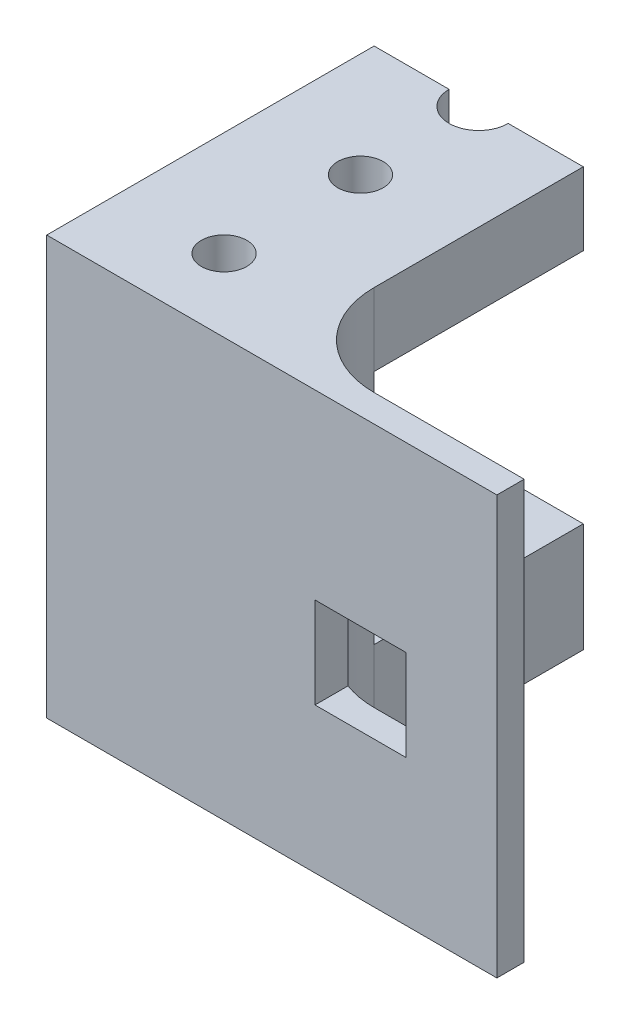
from build123d import *

# Parameters (mm, degrees)
SKETCH1_W                 = 23
SKETCH1_H                 = 33
BOSS_EXTRUDE1_DEPTH       = 46
CUT_EXTRUDE1_START        = 12
SKETCH2_W                 = 23
SKETCH2_H                 = 17
CUT_EXTRUDE1_DEPTH        = 26
SKETCH3_R                 = 2.5
CUT_EXTRUDE2_DEPTH        = 6
CUT_EXTRUDE3_START        = -6
SKETCH4_R                 = 2.5
CUT_EXTRUDE3_DEPTH        = 6
CHAMFER1_SIZE             = 6
BOSS_EXTRUDE2_DEPTH       = 26.5
BOSS_EXTRUDE2_DEPTH_BACK  = 23
SKETCH6_W                 = 3
SKETCH6_H                 = 46
F_5_0MM_DOWEL_HOLE1_D     = 5
F_5_0MM_DOWEL_HOLE1_DEPTH = 10
F_5_0MM_DOWEL_HOLE1_TIP   = 1.502151548
SKETCH14_W                = 10
SKETCH14_H                = 10
CUT_EXTRUDE4_DEPTH        = 70.685005561
FILLET1_DEPTH             = 46
FILLET1_START             = 26
FILLET1_2_DEPTH           = 20
FILLET1_3_DEPTH           = 16


with BuildPart() as part:
    # Sketch1 → Boss-Extrude1 (new body)
    with BuildSketch(Plane(origin=(0, 0, 0), x_dir=(1, 0, 0), z_dir=(0, 1, 0))):
        Rectangle(SKETCH1_W, SKETCH1_H)
    extrude(amount=BOSS_EXTRUDE1_DEPTH)

    # Sketch2 → Cut-Extrude1 (cut)
    with BuildSketch(Plane(origin=(0, 0, 0), x_dir=(1, 0, 0), z_dir=(0, 1, 0)).offset(CUT_EXTRUDE1_START)):
        with Locations((0, 8)):
            Rectangle(SKETCH2_W, SKETCH2_H)
    extrude(amount=CUT_EXTRUDE1_DEPTH, mode=Mode.SUBTRACT)

    # Sketch3 → Cut-Extrude2 (cut)
    with BuildSketch(Plane(origin=(0, 46, 0), x_dir=(1, 0, 0), z_dir=(0, 1, 0))):
        with Locations(Location((0, -11.5, 0), (0, 0, 270))):
            Circle(SKETCH3_R)
        with Locations(Location((0, 3.5, 0), (0, 0, 270))):
            Circle(SKETCH3_R)
    extrude(amount=-CUT_EXTRUDE2_DEPTH, mode=Mode.SUBTRACT)

    # Sketch4 → Cut-Extrude3 (cut)
    with BuildSketch(Plane.XZ.offset(CUT_EXTRUDE3_START)):
        with Locations(Location((0, -3.5, 0), (0, 0, 90))):
            Circle(SKETCH4_R)
        with Locations(Location((0, 11.5, 0), (0, 0, 90))):
            Circle(SKETCH4_R)
    extrude(amount=CUT_EXTRUDE3_DEPTH, mode=Mode.SUBTRACT)

    # Chamfer1
    chamfer1_edges = [part.edges().sort_by_distance(p)[0] for p in [
        (11.5, 25, 0.5),
    ]]
    chamfer(chamfer1_edges, length=CHAMFER1_SIZE)

    # Sketch6 → Boss-Extrude2 (add, two sides: drawn at the far end of the back side and taken through both)
    with BuildSketch(Plane(origin=(11.5, 0, 0), x_dir=(0, 0, -1), z_dir=(1, 0, 0)).offset(-BOSS_EXTRUDE2_DEPTH_BACK)):
        with Locations((-18, 23)):
            Rectangle(SKETCH6_W, SKETCH6_H)
    extrude(amount=BOSS_EXTRUDE2_DEPTH + BOSS_EXTRUDE2_DEPTH_BACK)

    # Ø5.0mm Dowel Hole1
    with Locations(Plane(origin=(0, 0, -16.5), x_dir=(-1, 0, 0), z_dir=(0, 0, -1))):
        with Locations((-8, 42), (-8, 8), (8, 8), (8, 42)):
            Hole(F_5_0MM_DOWEL_HOLE1_D / 2, depth=F_5_0MM_DOWEL_HOLE1_DEPTH)
            with Locations((0, 0, -(F_5_0MM_DOWEL_HOLE1_DEPTH + F_5_0MM_DOWEL_HOLE1_TIP / 2))):  # 118° drill point
                Cone(0, F_5_0MM_DOWEL_HOLE1_D / 2, F_5_0MM_DOWEL_HOLE1_TIP, mode=Mode.SUBTRACT)

    # Sketch14 → Cut-Extrude4 (cut, through all)
    with BuildSketch(Plane.XY.offset(19.5)):
        with Locations((23, 21)):
            Rectangle(SKETCH14_W, SKETCH14_H)
    extrude(amount=-CUT_EXTRUDE4_DEPTH, mode=Mode.SUBTRACT)

    # Sketch15 → Cut-Revolve1 (revolve, cut)
    with BuildSketch(Plane(origin=(0, 0, 0), x_dir=(0, 0, -1), z_dir=(1, 0, 0))):
        Polygon((16.5, 46), (13.25, 46), (13.25, 41.999935081), (11.5, 41.999935081), (11.5, 7), (13.25, 7), (13.25, 0), (16.5, 0), align=None)
    revolve(axis=Axis((0, 0, -16.5), (0, 1, 0)), mode=Mode.SUBTRACT)

    # Fillet1: read off the stored shape, not the designer's step
    # Fillet1 outline → Fillet1 (add)
    with BuildSketch(Plane(origin=(0, 0, 0), x_dir=(1, 0, 0), z_dir=(0, 1, 0))):
        with BuildLine():
            Line((18, -16.5), (18, -15.867496998))
            ThreePointArc((18, -15.867496998), (13.284161637, -12.200877126), (11.5, -6.5))
            Line((11.5, -6.5), (11.5, -16.5))
            Line((11.5, -16.5), (18, -16.5))
        make_face()
    extrude(amount=FILLET1_DEPTH)

    # Fillet1 2 outline → Fillet1 2 (add)
    with BuildSketch(Plane(origin=(0, 0, 0), x_dir=(1, 0, 0), z_dir=(0, 1, 0)).offset(FILLET1_START)):
        with BuildLine():
            ThreePointArc((21.5, -16.5), (19.721653855, -16.340603894), (18, -15.867496998))
            Line((18, -15.867496998), (18, -16.5))
            Line((18, -16.5), (21.5, -16.5))
        make_face()
    extrude(amount=FILLET1_2_DEPTH)

    # Fillet1 3 outline → Fillet1 3 (add)
    with BuildSketch(Plane(origin=(0, 0, 0), x_dir=(1, 0, 0), z_dir=(0, 1, 0))):
        with BuildLine():
            ThreePointArc((21.5, -16.5), (19.721653855, -16.340603894), (18, -15.867496998))
            Line((18, -15.867496998), (18, -16.5))
            Line((18, -16.5), (21.5, -16.5))
        make_face()
    extrude(amount=FILLET1_3_DEPTH)


solid = part.part
